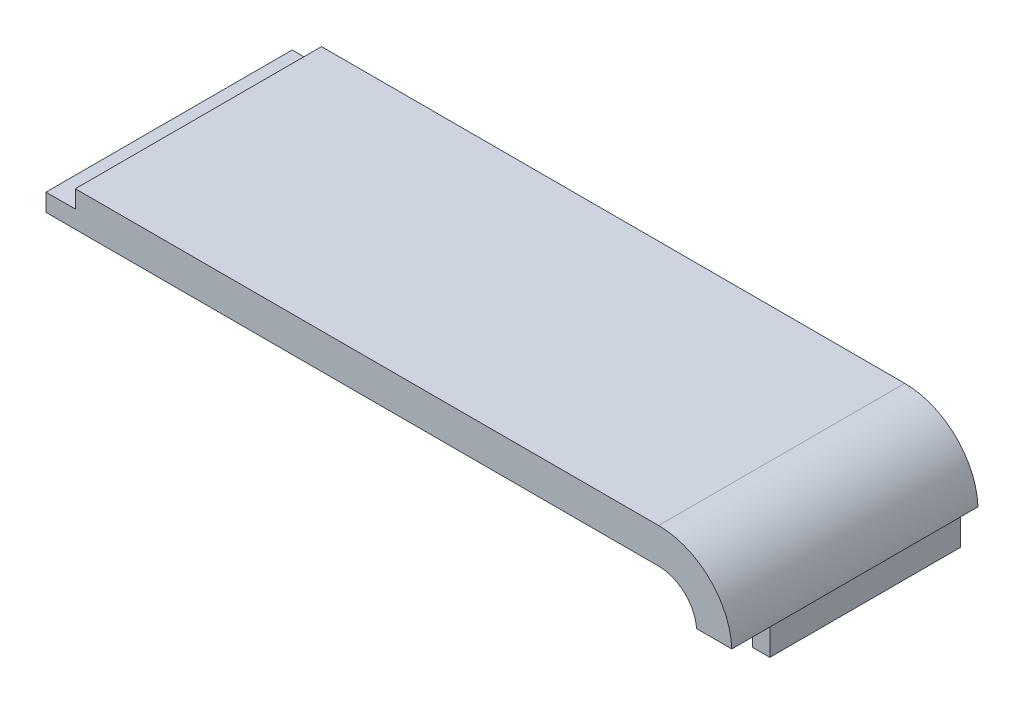
from build123d import *

# Parameters (mm, degrees)
SKETCH1_W           = 44.8
SKETCH1_H           = 4.8
BOSS_EXTRUDE1_DEPTH = 16.8
FILLET1_R           = 5
CUT_EXTRUDE1_DEPTH  = 32.95768929
SKETCH3_W           = 1.2
SKETCH3_H           = 13
BOSS_EXTRUDE2_DEPTH = 3
SKETCH4_W           = 16.8
SKETCH4_H           = 1.2
BOSS_EXTRUDE3_DEPTH = 2
SKETCH5_R           = 1
BOSS_EXTRUDE4_DEPTH = 2
FILLET2_R           = 2


with BuildPart() as part:
    # Sketch1 → Boss-Extrude1 (new body)
    with BuildSketch(Plane.XY):
        with Locations((4.109677419, 3.624193548)):
            Rectangle(SKETCH1_W, SKETCH1_H)
    extrude(amount=BOSS_EXTRUDE1_DEPTH)

    # Fillet1
    # the kernel refuses this fillet: 5 mm, written as the material it takes off along each edge
    with BuildSketch(Plane(origin=(26.509677419, 6.024193548, -12.489995997), x_dir=(-1, 0, 0), z_dir=(0, 0, 1))) as fillet1_piece_1:
        with BuildLine():
            CenterArc((4.995998399, 5), FILLET1_R, 182.292442776, 87.707557224)
            Line((0, 4.8), (-0.099919968, 4.796))
            ThreePointArc((-0.099919968, 4.796), (-0.1, 2.4), (-0.1, 0))
            Line((-0.1, 0), (0, -0.1))
            Line((0, -0.1), (4.995998399, -0.1))
            Line((4.995998399, -0.1), (4.995998399, 0))
        make_face()
    extrude(amount=41.779991994, mode=Mode.SUBTRACT)

    # Sketch2 → Cut-Extrude1 (cut, through all)
    with BuildSketch(Plane(origin=(0, 0, 0), x_dir=(-1, 0, 0), z_dir=(0, 0, -1))):
        with BuildLine():
            Line((-24.1059753, 1.224193548), (18.290322581, 1.224193548))
            Line((18.290322581, 1.224193548), (18.290322581, 3.624193548))
            Line((18.290322581, 3.624193548), (-21.513679021, 3.624193548))
            ThreePointArc((-21.513679021, 3.624193548), (-23.280031194, 2.932071951), (-24.1059753, 1.224193548))
        make_face()
    extrude(amount=-CUT_EXTRUDE1_DEPTH, mode=Mode.SUBTRACT)

    # Sketch3 → Boss-Extrude2 (add)
    with BuildSketch(Plane.XZ.offset(-1.224193548)):
        with Locations((24.7059753, 6.5)):
            Rectangle(SKETCH3_W, SKETCH3_H)
    extrude(amount=BOSS_EXTRUDE2_DEPTH)

    # Sketch4 → Boss-Extrude3 (add)
    with BuildSketch(Plane.ZY.offset(18.290322581)):
        with Locations((8.4, 4.224193548)):
            Rectangle(SKETCH4_W, SKETCH4_H)
    extrude(amount=BOSS_EXTRUDE3_DEPTH)

    # Sketch5 → Boss-Extrude4 (add)
    with BuildSketch(Plane(origin=(0, 0, 0), x_dir=(-1, 0, 0), z_dir=(0, 0, -1))):
        with BuildLine():
            Line((-18.1059753, -0.775806452), (-18.1059753, 3.624193548))
            Line((-18.1059753, 3.624193548), (-21.513679021, 3.624193548))
            ThreePointArc((-21.513679021, 3.624193548), (-23.280031194, 2.932071951), (-24.1059753, 1.224193548))
            Line((-24.1059753, 1.224193548), (-24.1059753, -0.775806452))
            Line((-24.1059753, -0.775806452), (-18.1059753, -0.775806452))
        make_face()
        with Locations((-21.513679021, 1.024193548)):
            Circle(SKETCH5_R, mode=Mode.SUBTRACT)
    extrude(amount=-BOSS_EXTRUDE4_DEPTH)

    # Fillet2
    fillet2_edges = [part.edges().sort_by_distance(p)[0] for p in [
        (18.1059753, -0.775806452, 1),
    ]]
    fillet(fillet2_edges, radius=FILLET2_R)


solid = part.part
